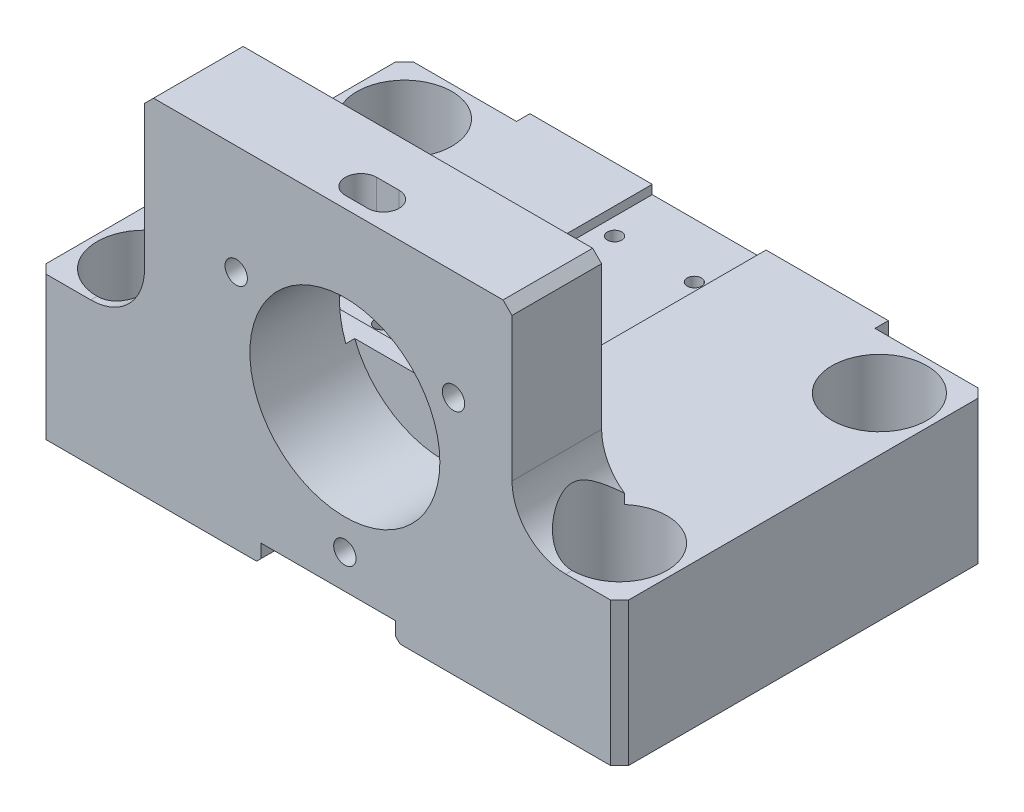
from build123d import *

# Parameters (mm, degrees)
SKETCH1_W                                     = 65
SKETCH1_H                                     = 41
BOSS_EXTRUDE1_DEPTH                           = 16
SKETCH15_W                                    = 41
SKETCH15_H                                    = 10
BOSS_EXTRUDE4_DEPTH                           = 23
SKETCH4_R                                     = 10.6
CUT_EXTRUDE3_DEPTH                            = 11
M3_TAPPED_HOLE1_D                             = 2.5
M3_TAPPED_HOLE1_DEPTH                         = 8.5
M3_TAPPED_HOLE1_TIP                           = 0.751075774
CUT_EXTRUDE4_START                            = -1
CUT_EXTRUDE4_DEPTH                            = 1
SKETCH30_W                                    = 40
SKETCH30_H                                    = 3
BOSS_EXTRUDE5_DEPTH                           = 1.5
SKETCH27_W                                    = 12.7
SKETCH27_H                                    = 4.1
CUT_EXTRUDE6_DEPTH                            = 1
CUT_EXTRUDE7_DEPTH                            = 1
M2_TAPPED_HOLE1_D                             = 1.6
M2_TAPPED_HOLE1_DEPTH                         = 6
M2_TAPPED_HOLE1_TIP                           = 0.480688495
CBORE_FOR_M4_HEX_HEAD_MACHINE_SCREW1_AT_COUNT = 2
CBORE_FOR_M4_HEX_HEAD_MACHINE_SCREW1_AT_PITCH = 53
CBORE_FOR_M4_HEX_HEAD_MACHINE_SCREW1_2_COUNT  = 2
CBORE_FOR_M4_HEX_HEAD_MACHINE_SCREW1_2_PITCH  = 60.415229868
CBORE_FOR_M4_HEX_HEAD_MACHINE_SCREW1_3_COUNT  = 2
CBORE_FOR_M4_HEX_HEAD_MACHINE_SCREW1_3_PITCH  = 29
CHAMFER4_SIZE                                 = 1
F_3_5_START                                   = 44
F_3_5_3_5_DIAMETER_SLOT1_DEPTH                = 10
FILLET1_R                                     = 6
SKETCH33_W                                    = 15
SKETCH33_H                                    = 41
CUT_EXTRUDE8_DEPTH                            = 2
CHAMFER5_SIZE                                 = 0.5


with BuildPart() as part:
    # Sketch1 → Boss-Extrude1 (new body)
    with BuildSketch(Plane(origin=(0, 15, 0), x_dir=(1, 0, 0), z_dir=(0, 1, 0))):
        with Locations((0, 20)):
            Rectangle(SKETCH1_W, SKETCH1_H)
    extrude(amount=BOSS_EXTRUDE1_DEPTH)

    # Sketch15 → Boss-Extrude4 (add)
    with BuildSketch(Plane(origin=(0, 31, 0), x_dir=(1, 0, 0), z_dir=(0, 1, 0))):
        with Locations((0, 4.5)):
            Rectangle(SKETCH15_W, SKETCH15_H)
    extrude(amount=BOSS_EXTRUDE4_DEPTH)

    # Sketch4 → Cut-Extrude3 (cut)
    with BuildSketch(Plane.XY.offset(0.5)):
        with Locations((1.85, 34.8)):
            Circle(SKETCH4_R)
    extrude(amount=-CUT_EXTRUDE3_DEPTH, mode=Mode.SUBTRACT)

    # M3 Tapped Hole1
    with Locations(Plane.XY.offset(0.5)):
        with Locations((13.974355653, 41.8), (1.85, 20.8), (-10.274355653, 41.8)):
            Hole(M3_TAPPED_HOLE1_D / 2, depth=M3_TAPPED_HOLE1_DEPTH)
            with Locations((0, 0, -(M3_TAPPED_HOLE1_DEPTH + M3_TAPPED_HOLE1_TIP / 2))):  # 118° drill point
                Cone(0, M3_TAPPED_HOLE1_D / 2, M3_TAPPED_HOLE1_TIP, mode=Mode.SUBTRACT)

    # Sketch16 → Cut-Extrude4 (cut)
    with BuildSketch(Plane(origin=(0, 31, 0), x_dir=(1, 0, 0), z_dir=(0, 1, 0)).offset(CUT_EXTRUDE4_START)):
        Polygon((-10.95, 12.5), (10.95, 12.5), (10.95, 16.3), (6.35, 16.3), (6.35, 37.9), (-6.35, 37.9), (-6.35, 16.3), (-10.95, 16.3), align=None)
    extrude(amount=CUT_EXTRUDE4_DEPTH, mode=Mode.SUBTRACT)

    # Sketch30 → Boss-Extrude5 (add)
    with BuildSketch(Plane(origin=(0, 0, -40.5), x_dir=(-1, 0, 0), z_dir=(0, 0, -1))):
        with Locations((0, 29.5)):
            Rectangle(SKETCH30_W, SKETCH30_H)
    extrude(amount=BOSS_EXTRUDE5_DEPTH)

    # Sketch27 → Cut-Extrude6 (cut)
    with BuildSketch(Plane(origin=(0, 30, 0), x_dir=(1, 0, 0), z_dir=(0, 1, 0))):
        with Locations((0, 39.95)):
            Rectangle(SKETCH27_W, SKETCH27_H)
    extrude(amount=CUT_EXTRUDE6_DEPTH, mode=Mode.SUBTRACT)

    # Sketch28 → Cut-Extrude7 (cut)
    with BuildSketch(Plane(origin=(0, 30, 0), x_dir=(1, 0, 0), z_dir=(0, 1, 0))):
        with BuildLine():
            Line((10.95, 12.5), (12.45, 12.5))
            ThreePointArc((12.45, 12.5), (13.510660172, 12.939339828), (13.95, 14))
            Line((13.95, 14), (13.95, 14.8))
            ThreePointArc((13.95, 14.8), (13.510660172, 15.860660172), (12.45, 16.3))
            Line((12.45, 16.3), (10.95, 16.3))
            Line((10.95, 16.3), (10.95, 12.5))
        make_face()
    cut_extrude7 = extrude(amount=CUT_EXTRUDE7_DEPTH, mode=Mode.SUBTRACT)

    # Mirror1: Cut-Extrude7 across plane
    add(cut_extrude7.mirror(Plane(origin=(0, 0, 0), x_dir=(0, 0, 1), z_dir=(1, 0, 0))), mode=Mode.SUBTRACT)

    # M2 Tapped Hole1
    with Locations(Plane(origin=(0, 30, 0), x_dir=(1, 0, 0), z_dir=(0, 1, 0))):
        with Locations((-4.45, 35.9), (4.45, 35.9), (8.95, 14.4), (-8.95, 14.4)):
            Hole(M2_TAPPED_HOLE1_D / 2, depth=M2_TAPPED_HOLE1_DEPTH)
            with Locations((0, 0, -(M2_TAPPED_HOLE1_DEPTH + M2_TAPPED_HOLE1_TIP / 2))):  # 118° drill point
                Cone(0, M2_TAPPED_HOLE1_D / 2, M2_TAPPED_HOLE1_TIP, mode=Mode.SUBTRACT)

    # Sketch21 → CBORE for M4 Hex Head Machine Screw1 (revolve, cut)
    with BuildSketch(Plane(origin=(26.5, 31, -34.5), x_dir=(0, 0, 1), z_dir=(1, 0, 0))):
        Polygon((0, 0), (0, 16), (2.25, 16), (2.15, 15.9), (2.15, 8), (5.295, 8), (5.295, 0), align=None)
    cbore_for_m4_hex_head_machine_screw1 = revolve(axis=Axis((26.5, 37.35, -34.5), (0, -1, 0)), mode=Mode.SUBTRACT)

    # CBORE for M4 Hex Head Machine Screw1 at: CBORE for M4 Hex Head Machine Screw1 ×2
    with Locations(*[(-i * CBORE_FOR_M4_HEX_HEAD_MACHINE_SCREW1_AT_PITCH, 0, 0) for i in range(1, CBORE_FOR_M4_HEX_HEAD_MACHINE_SCREW1_AT_COUNT)]):
        add(cbore_for_m4_hex_head_machine_screw1, mode=Mode.SUBTRACT)

    # CBORE for M4 Hex Head Machine Screw1 2: CBORE for M4 Hex Head Machine Screw1 ×2
    with Locations(*[Vector(-0.8772622419185101, 0, 0.4800114153893735) * (i * CBORE_FOR_M4_HEX_HEAD_MACHINE_SCREW1_2_PITCH) for i in range(1, CBORE_FOR_M4_HEX_HEAD_MACHINE_SCREW1_2_COUNT)]):
        add(cbore_for_m4_hex_head_machine_screw1, mode=Mode.SUBTRACT)

    # CBORE for M4 Hex Head Machine Screw1 3: CBORE for M4 Hex Head Machine Screw1 ×2
    with Locations(*[(0, 0, i * CBORE_FOR_M4_HEX_HEAD_MACHINE_SCREW1_3_PITCH) for i in range(1, CBORE_FOR_M4_HEX_HEAD_MACHINE_SCREW1_3_COUNT)]):
        add(cbore_for_m4_hex_head_machine_screw1, mode=Mode.SUBTRACT)

    # Chamfer4
    chamfer4_edges = [part.edges().sort_by_distance(p)[0] for p in [
        (-20.5, 54, -4.5),
        (20.5, 54, -4.5),
        (32.5, 23, 0.5),
        (-32.5, 23, 0.5),
        (32.5, 23, -40.5),
        (-32.5, 23, -40.5),
    ]]
    chamfer(chamfer4_edges, length=CHAMFER4_SIZE)

    # Ø3.5 (3.5) Diameter Slot1: read off the stored shape, not the designer's step
    # Ø3.5 (3.5) Diameter Slot1 outline → Ø3.5 (3.5) Diameter Slot1 (cut)
    with BuildSketch(Plane(origin=(0, 0, 0), x_dir=(1, 0, 0), z_dir=(0, 1, 0)).offset(F_3_5_START)):
        with BuildLine():
            Line((0.6, 0.8035), (3.1, 0.8035))
            ThreePointArc((3.1, 0.8035), (4.85, 2.5535), (3.1, 4.3035))
            Line((3.1, 4.3035), (0.6, 4.3035))
            ThreePointArc((0.6, 4.3035), (-1.15, 2.5535), (0.6, 0.8035))
        make_face()
    extrude(amount=F_3_5_3_5_DIAMETER_SLOT1_DEPTH, mode=Mode.SUBTRACT)

    # Fillet1
    # the kernel refuses this fillet: 6 mm, written as the material it adds along each edge
    with BuildSketch(Plane(origin=(20.5, 31, 0.5), x_dir=(1, 0, 0), z_dir=(0, 0, -1))) as fillet1_piece_1_section:
        with BuildLine():
            CenterArc((FILLET1_R, -FILLET1_R), FILLET1_R, 90, 90)
            Line((0, -FILLET1_R), (0, 0))
            Line((0, 0), (FILLET1_R, 0))
        make_face()
    fillet1_piece_1 = extrude(amount=10, mode=Mode.PRIVATE)
    fillet1_piece_1 = fillet1_piece_1 - Plane(origin=(26.5, 31, -5.5), x_dir=(0, 0, 1), z_dir=(0, 1, 0)) * Cylinder(5.295, 45, mode=Mode.PRIVATE)
    add(fillet1_piece_1)
    with BuildSketch(Plane(origin=(-20.5, 31, -9.5), x_dir=(-1, 0, 0), z_dir=(0, 0, 1))) as fillet1_piece_2_section:
        with BuildLine():
            CenterArc((FILLET1_R, -FILLET1_R), FILLET1_R, 90, 90)
            Line((0, -FILLET1_R), (0, 0))
            Line((0, 0), (FILLET1_R, 0))
        make_face()
    fillet1_piece_2 = extrude(amount=10, mode=Mode.PRIVATE)
    fillet1_piece_2 = fillet1_piece_2 - Plane(origin=(-26.5, 31, -5.5), x_dir=(0, 0, 1), z_dir=(0, 1, 0)) * Cylinder(5.295, 45, mode=Mode.PRIVATE)
    add(fillet1_piece_2)

    # Sketch33 → Cut-Extrude8 (cut)
    with BuildSketch(Plane.XZ.offset(-15)):
        with Locations((0, -20)):
            Rectangle(SKETCH33_W, SKETCH33_H)
    extrude(amount=-CUT_EXTRUDE8_DEPTH, mode=Mode.SUBTRACT)

    # Chamfer5
    chamfer5_edges = [part.edges().sort_by_distance(p)[0] for p in [
        (7.5, 15, -20),
        (-7.5, 15, -20),
    ]]
    chamfer(chamfer5_edges, length=CHAMFER5_SIZE)


solid = part.part
